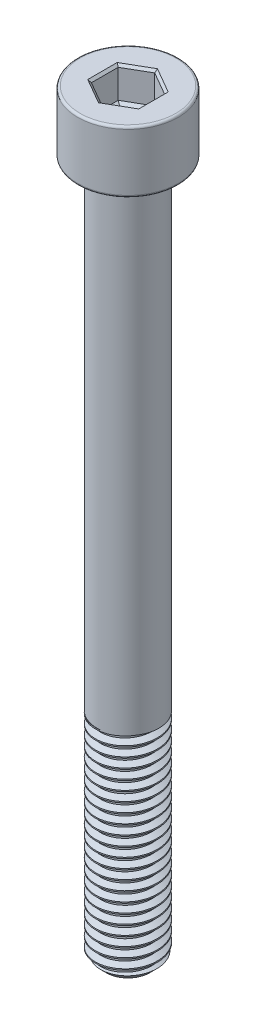
from build123d import *

# Parameters (mm, degrees)
SKETCH1_R           = 4
BOSS_EXTRUDE1_DEPTH = 28
THREAD1_PITCH       = 1.25
SKETCH2_R           = 4
BOSS_EXTRUDE2_DEPTH = 62
SKETCH5_R           = 6.5
BOSS_EXTRUDE3_DEPTH = 8
FILLET1_R           = 0.3
CUT_EXTRUDE1_DEPTH  = 4
CHAMFER1_SIZE       = 0.3
CUT_EXTRUDE2_DEPTH  = 0.4
CUT_EXTRUDE2_DRAFT  = -60


with BuildPart() as part:
    # Sketch1 → Boss-Extrude1 (new body)
    with BuildSketch(Plane(origin=(0, 0, 0), x_dir=(1, 0, 0), z_dir=(0, 1, 0))):
        with Locations(Location((0, 0, 0), (0, 0, 270))):
            Circle(SKETCH1_R)
    extrude(amount=BOSS_EXTRUDE1_DEPTH)

    # Thread1: the profile of Thread Profile1 profile screwed along a right-hand helix of 24 turns, 8 arcs to a turn; built about Z, then put on its axis
    thread1_z = Axis((0, 0, 0), (0, 0, 1))
    thread1_corners = [(4.0003, 0, -0.000173205), (4.0003, 0, 1.093923202), (3.323417656, 0, 0.703124998), (3.323417656, 0, 0.390624998)]
    with BuildLine(mode=Mode.PRIVATE) as thread1_profile:
        Line(thread1_corners[0], thread1_corners[1])
        Line(thread1_corners[1], thread1_corners[2])
        Line(thread1_corners[2], thread1_corners[3])
        Line(thread1_corners[3], thread1_corners[0])
    thread1_cap = Face(thread1_profile.wire())
    thread1_turn_angles = [0, 22.5, 45, 67.5, 90, 112.5, 135, 157.5, 180, 202.5, 225, 247.5, 270, 292.5, 315, 337.5, 360]
    thread1_turn_weights = [1, 0.9238795325112867, 1, 0.9238795325112867, 1, 0.9238795325112867, 1, 0.9238795325112867, 1, 0.9238795325112867, 1, 0.9238795325112867, 1, 0.9238795325112867, 1, 0.9238795325112867, 1]
    thread1_turn_rails = [Edge.make_bspline([Vector(p[0], p[1], 0).rotate(thread1_z, thread1_turn_angles[k]) / thread1_turn_weights[k] + Vector(0, 0, p[2] + THREAD1_PITCH * thread1_turn_angles[k] / 360) for k in range(17)], [0, 0, 0, 1, 1, 2, 2, 3, 3, 4, 4, 5, 5, 6, 6, 7, 7, 8, 8, 8], 2, thread1_turn_weights) for p in thread1_corners]
    thread1_turn_sides = [Face.make_surface_from_curves(thread1_turn_rails[p[0]], thread1_turn_rails[p[1]]) for p in [(0, 1), (1, 2), (2, 3), (3, 0)]]
    thread1 = Plane(origin=(0, 30, 0), x_dir=(-1, 0, 0), z_dir=(0, -1, 0)) * Solid(Shell([*[p.moved(Location((0, 0, THREAD1_PITCH * i))) for i in range(24) for p in thread1_turn_sides], thread1_cap, thread1_cap.rotate(thread1_z, 8640).moved(Location((0, 0, THREAD1_PITCH * 8640 / 360)))]))
    add(thread1, mode=Mode.SUBTRACT)

    # Sketch2 → Boss-Extrude2 (add)
    with BuildSketch(Plane(origin=(0, 28, 0), x_dir=(1, 0, 0), z_dir=(0, 1, 0))):
        with Locations(Location((0, 0, 0), (0, 0, 117.593571361))):
            Circle(SKETCH2_R)
    extrude(amount=BOSS_EXTRUDE2_DEPTH)

    # Sketch5 → Boss-Extrude3 (add)
    with BuildSketch(Plane(origin=(0, 90, 0), x_dir=(1, 0, 0), z_dir=(0, 1, 0))):
        with Locations(Location((0, 0, 0), (0, 0, 270))):
            Circle(SKETCH5_R)
    extrude(amount=BOSS_EXTRUDE3_DEPTH)

    # Sketch6 → Cut-Revolve1 (revolve, cut)
    with BuildSketch(Plane.XY, mode=Mode.PRIVATE) as cut_revolve1_sk:
        Polygon((4.01, 0), (4.01, 1.2), (2.81, 0), align=None)
    revolve(cut_revolve1_sk.sketch.rotate(Axis((0, 0, 0), (0, 1, 0)), 117.593571361), axis=Axis((0, 0, 0), (0, 1, 0)), mode=Mode.SUBTRACT)

    # Fillet1
    fillet1_edges = [part.edges().sort_by_distance(p)[0] for p in [
        (0, 90, -6.5),
        (0, 98, -6.5),
    ]]
    fillet(fillet1_edges, radius=FILLET1_R)

    # Sketch7 → Cut-Extrude1 (cut)
    with BuildSketch(Plane(origin=(0, 98, 0), x_dir=(1, 0, 0), z_dir=(0, 1, 0))):
        Polygon((0, 3.464101615), (-3, 1.732050808), (-3, -1.732050808), (0, -3.464101615), (3, -1.732050808), (3, 1.732050808), align=None)
    extrude(amount=-CUT_EXTRUDE1_DEPTH, mode=Mode.SUBTRACT)

    # Chamfer1
    chamfer1_edges = [part.edges().sort_by_distance(p)[0] for p in [
        (1.5, 98, -2.598076211),
        (-1.5, 98, -2.598076211),
        (-3, 98, 0),
        (-1.5, 98, 2.598076211),
        (1.5, 98, 2.598076211),
        (3, 98, 0),
    ]]
    chamfer(chamfer1_edges, length=CHAMFER1_SIZE)


with BuildPart() as cut_extrude2_tool:
    # Sketch8 → Cut-Extrude2 (with draft: the straight prism first)
    with BuildSketch(Plane(origin=(0, 94, 0), x_dir=(1, 0, 0), z_dir=(0, 1, 0))):
        Polygon((0, 3.464101615), (-3, 1.732050808), (-3, -1.732050808), (0, -3.464101615), (3, -1.732050808), (3, 1.732050808), align=None)
    extrude(amount=-CUT_EXTRUDE2_DEPTH)
    # Cut-Extrude2: the draft: its side faces are tilted about the plane it starts from
    cut_extrude2_sides = [cut_extrude2_tool.faces().sort_by_distance(p)[0] for p in [
        (-1.5, 93.8, -2.598076211),
        (-3, 93.8, 0),
        (-1.5, 93.8, 2.598076211),
        (1.5, 93.8, 2.598076211),
        (3, 93.8, 0),
        (1.5, 93.8, -2.598076211),
    ]]
    draft(cut_extrude2_sides, Plane(origin=(0, 94, 0), x_dir=(1, 0, 0), z_dir=(0, 1, 0)), CUT_EXTRUDE2_DRAFT)


with BuildPart() as part_1:
    add(part.part)

    # Cut-Extrude2: cut by cut_extrude2_tool
    add(cut_extrude2_tool.part, mode=Mode.SUBTRACT)


solid = part_1.part
